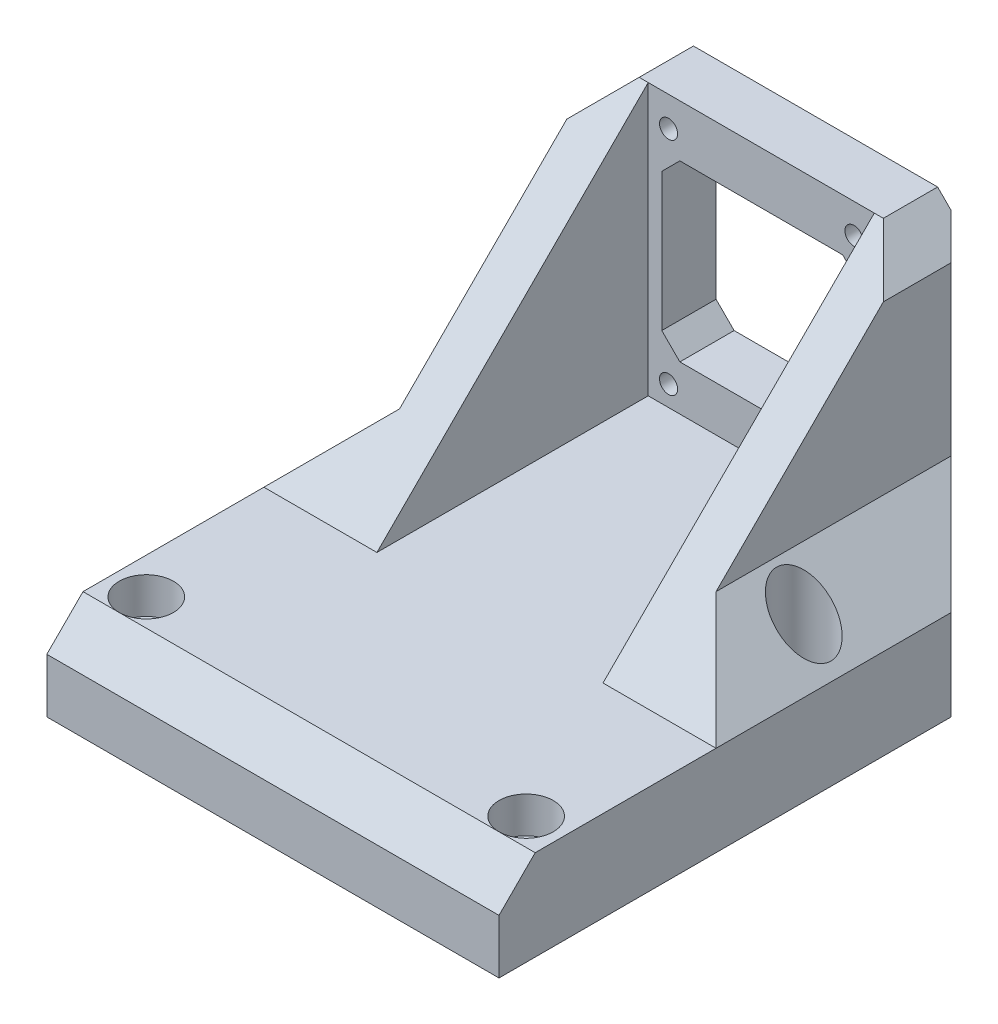
from build123d import *

# Parameters (mm, degrees)
SKETCH1_W           = 50
SKETCH1_H           = 60
BOSS_EXTRUDE1_DEPTH = 10
SKETCH2_R           = 1.5
CUT_EXTRUDE1_DEPTH  = 6
CUT_EXTRUDE2_REACH  = 41.509
SKETCH3_R           = 3
SKETCH5_W           = 25
SKETCH5_H           = 6
BOSS_EXTRUDE3_DEPTH = 30
CUT_EXTRUDE3_REACH  = 78.322
SKETCH6_W           = 22
SKETCH6_H           = 19.25
SKETCH7_R           = 1
CUT_EXTRUDE4_DEPTH  = 2.5
CUT_EXTRUDE5_REACH  = 75.602
SKETCH8_R           = 2
BOSS_EXTRUDE4_DEPTH = 5
CHAMFER1_SIZE       = 7.5
CHAMFER2_SIZE       = 10
CHAMFER4_SIZE       = 6.5
CHAMFER5_SIZE       = 4
CHAMFER6_SIZE       = 4
CHAMFER7_SIZE       = 2


# Some blends are built 0.0001 mm under size
with BuildPart() as part:
    # Sketch1 → Boss-Extrude1 (new body)
    with BuildSketch(Plane(origin=(0, 0, 0), x_dir=(1, 0, 0), z_dir=(0, 1, 0))):
        Rectangle(SKETCH1_W, SKETCH1_H)
    extrude(amount=BOSS_EXTRUDE1_DEPTH)

    # Sketch2 → Cut-Extrude1 (cut)
    with BuildSketch(Plane(origin=(0, 0, 0), x_dir=(1, 0, 0), z_dir=(0, 1, 0))):
        with Locations(Location((-21, 7.7, 0), (0, 0, 270))):
            Circle(SKETCH2_R)
        with Locations(Location((-21, -23, 0), (0, 0, 270))):
            Circle(SKETCH2_R)
        with Locations(Location((21, 7.7, 0), (0, 0, 270))):
            Circle(SKETCH2_R)
        with Locations(Location((21, -23, 0), (0, 0, 270))):
            Circle(SKETCH2_R)
    extrude(amount=CUT_EXTRUDE1_DEPTH, mode=Mode.SUBTRACT)

    # Sketch3 → Cut-Extrude2 (cut, up to next)
    with BuildSketch(Plane.XZ.offset(-6), mode=Mode.PRIVATE) as cut_extrude2_sk1:
        with Locations(Location((-21, 23, 0), (0, 0, 270))):
            Circle(SKETCH3_R)
    cut_extrude2_tool1 = extrude(cut_extrude2_sk1.sketch, amount=-CUT_EXTRUDE2_REACH, mode=Mode.PRIVATE) & part.part
    # Sketch3 → Cut-Extrude2 (cut, up to next)
    with BuildSketch(Plane.XZ.offset(-6), mode=Mode.PRIVATE) as cut_extrude2_sk2:
        with Locations(Location((21, 23, 0), (0, 0, 270))):
            Circle(SKETCH3_R)
    cut_extrude2_tool2 = extrude(cut_extrude2_sk2.sketch, amount=-CUT_EXTRUDE2_REACH, mode=Mode.PRIVATE) & part.part
    # Sketch3 → Cut-Extrude2 (cut, up to next)
    with BuildSketch(Plane.XZ.offset(-6), mode=Mode.PRIVATE) as cut_extrude2_sk3:
        with Locations(Location((21, -7.7, 0), (0, 0, 270))):
            Circle(SKETCH3_R)
    cut_extrude2_tool3 = extrude(cut_extrude2_sk3.sketch, amount=-CUT_EXTRUDE2_REACH, mode=Mode.PRIVATE) & part.part
    # Sketch3 → Cut-Extrude2 (cut, up to next)
    with BuildSketch(Plane.XZ.offset(-6), mode=Mode.PRIVATE) as cut_extrude2_sk4:
        with Locations(Location((-21, -7.7, 0), (0, 0, 270))):
            Circle(SKETCH3_R)
    cut_extrude2_tool4 = extrude(cut_extrude2_sk4.sketch, amount=-CUT_EXTRUDE2_REACH, mode=Mode.PRIVATE) & part.part
    add(cut_extrude2_tool1.solids().sort_by_distance((-21, 6, 23))[0], mode=Mode.SUBTRACT)
    add(cut_extrude2_tool2.solids().sort_by_distance((21, 6, 23))[0], mode=Mode.SUBTRACT)
    add(cut_extrude2_tool3.solids().sort_by_distance((21, 6, -7.7))[0], mode=Mode.SUBTRACT)
    add(cut_extrude2_tool4.solids().sort_by_distance((-21, 6, -7.7))[0], mode=Mode.SUBTRACT)

    # Sketch5 → Boss-Extrude3 (add)
    with BuildSketch(Plane(origin=(0, 10, 0), x_dir=(1, 0, 0), z_dir=(0, 1, 0))):
        with Locations((0, 27)):
            Rectangle(SKETCH5_W, SKETCH5_H)
    extrude(amount=BOSS_EXTRUDE3_DEPTH)

    # Sketch6 → Cut-Extrude3 (cut, up to next)
    with BuildSketch(Plane(origin=(0, 0, -30), x_dir=(-1, 0, 0), z_dir=(0, 0, -1)), mode=Mode.PRIVATE) as cut_extrude3_sk1:
        with Locations((0, 24.625)):
            Rectangle(SKETCH6_W, SKETCH6_H)
    cut_extrude3_tool1 = extrude(cut_extrude3_sk1.sketch, amount=-CUT_EXTRUDE3_REACH, mode=Mode.PRIVATE) & part.part
    add(cut_extrude3_tool1.solids().sort_by_distance((0, 24.625, -30))[0], mode=Mode.SUBTRACT)

    # Sketch7 → Cut-Extrude4 (cut)
    with BuildSketch(Plane.XY.offset(-24)):
        with Locations((10.25, 12.25)):
            Circle(SKETCH7_R)
        with Locations((-10.25, 12.25)):
            Circle(SKETCH7_R)
        with Locations((-10.25, 36.7)):
            Circle(SKETCH7_R)
        with Locations((10.25, 36.7)):
            Circle(SKETCH7_R)
    extrude(amount=-CUT_EXTRUDE4_DEPTH, mode=Mode.SUBTRACT)

    # Sketch8 → Cut-Extrude5 (cut, up to next)
    with BuildSketch(Plane.XY.offset(-26.5), mode=Mode.PRIVATE) as cut_extrude5_sk1:
        with Locations((-10.25, 36.7)):
            Circle(SKETCH8_R)
    cut_extrude5_tool1 = extrude(cut_extrude5_sk1.sketch, amount=-CUT_EXTRUDE5_REACH, mode=Mode.PRIVATE) & part.part
    # Sketch8 → Cut-Extrude5 (cut, up to next)
    with BuildSketch(Plane.XY.offset(-26.5), mode=Mode.PRIVATE) as cut_extrude5_sk2:
        with Locations((10.25, 36.7)):
            Circle(SKETCH8_R)
    cut_extrude5_tool2 = extrude(cut_extrude5_sk2.sketch, amount=-CUT_EXTRUDE5_REACH, mode=Mode.PRIVATE) & part.part
    # Sketch8 → Cut-Extrude5 (cut, up to next)
    with BuildSketch(Plane.XY.offset(-26.5), mode=Mode.PRIVATE) as cut_extrude5_sk3:
        with Locations((10.25, 12.25)):
            Circle(SKETCH8_R)
    cut_extrude5_tool3 = extrude(cut_extrude5_sk3.sketch, amount=-CUT_EXTRUDE5_REACH, mode=Mode.PRIVATE) & part.part
    # Sketch8 → Cut-Extrude5 (cut, up to next)
    with BuildSketch(Plane.XY.offset(-26.5), mode=Mode.PRIVATE) as cut_extrude5_sk4:
        with Locations((-10.25, 12.25)):
            Circle(SKETCH8_R)
    cut_extrude5_tool4 = extrude(cut_extrude5_sk4.sketch, amount=-CUT_EXTRUDE5_REACH, mode=Mode.PRIVATE) & part.part
    add(cut_extrude5_tool1.solids().sort_by_distance((-10.25, 36.7, -26.5))[0], mode=Mode.SUBTRACT)
    add(cut_extrude5_tool2.solids().sort_by_distance((10.25, 36.7, -26.5))[0], mode=Mode.SUBTRACT)
    add(cut_extrude5_tool3.solids().sort_by_distance((10.25, 12.25, -26.5))[0], mode=Mode.SUBTRACT)
    add(cut_extrude5_tool4.solids().sort_by_distance((-10.25, 12.25, -26.5))[0], mode=Mode.SUBTRACT)

    # Sketch9 → Boss-Extrude4 (add)
    with BuildSketch(Plane(origin=(12.5, 0, 0), x_dir=(0, 0, -1), z_dir=(1, 0, 0))):
        Polygon((30, 40), (24, 40), (-6, 10), (30, 10), align=None)
    boss_extrude4 = extrude(amount=BOSS_EXTRUDE4_DEPTH)

    # Mirror1: Boss-Extrude4 across plane
    add(boss_extrude4.mirror(Plane(origin=(0, 0, 0), x_dir=(0, 0, 1), z_dir=(1, 0, 0))))

    # Chamfer1
    # the kernel refuses this chamfer: 7.5 mm, written as the material it adds along each edge
    with BuildSketch(Plane(origin=(17.5, 10, 25.28762241), x_dir=(-0.02749587661058632, 0.9996219169112968, 0), z_dir=(0, 0, -1))) as chamfer1_piece_1_section:
        Polygon((CHAMFER1_SIZE * 0.999621916911, CHAMFER1_SIZE * 0.0274958766106), (-CHAMFER1_SIZE * 0.0274958766106, CHAMFER1_SIZE * 0.999621916911), (0, 0), align=None)
    chamfer1_piece_1 = extrude(amount=55.28762241, mode=Mode.PRIVATE)
    chamfer1_piece_1 = split(chamfer1_piece_1, bisect_by=Plane(origin=(19.963540821, 21.141387269, -5.141387269), z_dir=(0, -0.7071067811865512, -0.7071067811865438)), keep=Keep.TOP, mode=Mode.PRIVATE)
    chamfer1_piece_1 = chamfer1_piece_1 - Plane(origin=(21, 12.394681138, -7.7), x_dir=(0, 0, -1), z_dir=(0, -1, 0)) * Cylinder(3, 141, mode=Mode.PRIVATE)
    chamfer1_piece_1 = split(chamfer1_piece_1, bisect_by=Plane(origin=(25, 12.394681138, -13.888093401), z_dir=(-1, 0, 0)), keep=Keep.TOP, mode=Mode.PRIVATE)
    add(chamfer1_piece_1)
    with BuildSketch(Plane(origin=(-17.5, 10, 25.28762241), x_dir=(0.02749587661058632, 0.9996219169112968, 0), z_dir=(0, 0, -1))) as chamfer1_piece_2_section:
        Polygon((CHAMFER1_SIZE * 0.999621916911, -CHAMFER1_SIZE * 0.0274958766106), (-CHAMFER1_SIZE * 0.0274958766106, -CHAMFER1_SIZE * 0.999621916911), (0, 0), align=None)
    chamfer1_piece_2 = extrude(amount=55.28762241, mode=Mode.PRIVATE)
    chamfer1_piece_2 = split(chamfer1_piece_2, bisect_by=Plane(origin=(-19.963548268, 21.141369022, -5.141369022), z_dir=(0, -0.7071067811865512, -0.7071067811865438)), keep=Keep.TOP, mode=Mode.PRIVATE)
    chamfer1_piece_2 = chamfer1_piece_2 - Plane(origin=(-21, 12.394672857, -7.7), x_dir=(0, 0, -1), z_dir=(0, -1, 0)) * Cylinder(3, 141, mode=Mode.PRIVATE)
    chamfer1_piece_2 = split(chamfer1_piece_2, bisect_by=Plane(origin=(-25, 12.394672857, -13.888065186), z_dir=(1, 0, 0)), keep=Keep.TOP, mode=Mode.PRIVATE)
    add(chamfer1_piece_2)

    # Chamfer2
    chamfer2_edges = [part.edges().sort_by_distance(p)[0] for p in [
        (-25, 5, -30),
        (25, 5, -30),
    ]]
    chamfer(chamfer2_edges, length=CHAMFER2_SIZE)

    # Chamfer4
    chamfer4_edges = [part.edges().sort_by_distance(p)[0] for p in [
        (0, 0, -30),
    ]]
    chamfer(chamfer4_edges, length=CHAMFER4_SIZE)

    # Chamfer5
    chamfer5_edges = [part.edges().sort_by_distance(p)[0] for p in [
        (17.5, 40, -25.75),
        (-17.5, 40, -25.75),
    ]]
    chamfer(chamfer5_edges, length=CHAMFER5_SIZE)

    # Chamfer6
    chamfer6_edges = [part.edges().sort_by_distance(p)[0] for p in [
        (0, 10, 30),
    ]]
    chamfer(chamfer6_edges, length=CHAMFER6_SIZE - 0.0001)  # a hair under: the kernel refuses the full size

    # Chamfer7
    chamfer7_edges = [part.edges().sort_by_distance(p)[0] for p in [
        (-11, 34.25, -27),
        (-11, 15, -27),
        (11, 15, -27),
        (11, 34.25, -27),
    ]]
    chamfer(chamfer7_edges, length=CHAMFER7_SIZE)


solid = part.part
